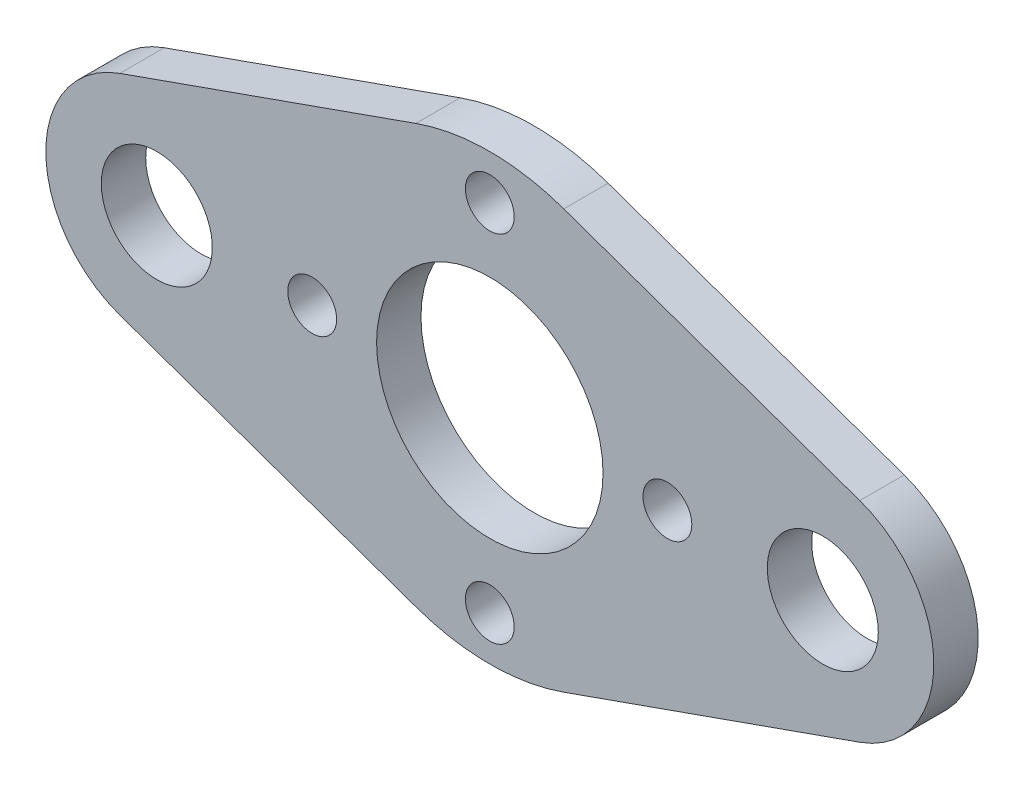
from build123d import *

# Parameters (mm, degrees)
SKETCH_1_R      = 1.1
SKETCH_1_R_2    = 5.1
SKETCH_1_R_3    = 2.5
EXTRUDE_1_DEPTH = 2


with BuildPart() as part:
    # 草图1 → 凸台-拉伸1 (new body)
    with BuildSketch(Plane.XY):
        with BuildLine():
            Line((3.333333333, 9.428090416), (16.666666667, 4.714045208))
            ThreePointArc((16.666666667, 4.714045208), (20, 0), (16.666666667, -4.714045208))
            Line((16.666666667, -4.714045208), (3.333333333, -9.428090416))
            ThreePointArc((3.333333333, -9.428090416), (0, -10), (-3.333333333, -9.428090416))
            Line((-3.333333333, -9.428090416), (-16.666666667, -4.714045208))
            ThreePointArc((-16.666666667, -4.714045208), (-20, 0), (-16.666666667, 4.714045208))
            Line((-16.666666667, 4.714045208), (-3.333333333, 9.428090416))
            ThreePointArc((-3.333333333, 9.428090416), (0, 10), (3.333333333, 9.428090416))
        make_face()
        with Locations((0, 8)):
            Circle(SKETCH_1_R, mode=Mode.SUBTRACT)
        with Locations((8, 0)):
            Circle(SKETCH_1_R, mode=Mode.SUBTRACT)
        with Locations((0, -8)):
            Circle(SKETCH_1_R, mode=Mode.SUBTRACT)
        with Locations((-8, 0)):
            Circle(SKETCH_1_R, mode=Mode.SUBTRACT)
        Circle(SKETCH_1_R_2, mode=Mode.SUBTRACT)
        with Locations((15, 0)):
            Circle(SKETCH_1_R_3, mode=Mode.SUBTRACT)
        with Locations((-15, 0)):
            Circle(SKETCH_1_R_3, mode=Mode.SUBTRACT)
    extrude(amount=EXTRUDE_1_DEPTH)


solid = part.part
